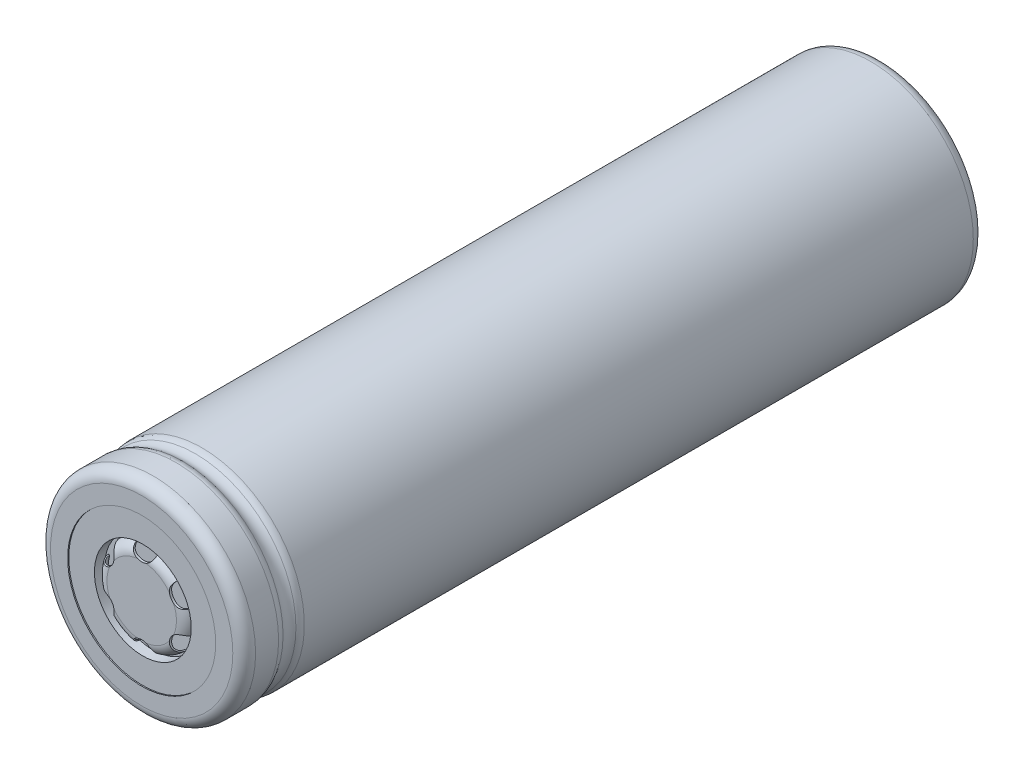
from build123d import *

# Parameters (mm, degrees)
SKETCH_1_R          = 9
EXTRUDE_1_DEPTH     = 65
SKETCH_2_R          = 4.25
SKETCH_2_R_2        = 4.05
CUT_EXTRUDE_1_DEPTH = 1
SKETCH_3_R          = 6.5
SKETCH_3_R_2        = 4.25
CUT_EXTRUDE_2_DEPTH = 0.1
FILLET_1_R          = 1
CUT_EXTRUDE_START   = -0.1
SKETCH_4_R          = 6.5
CUT_EXTRUDE_3_DEPTH = 0.1
FILLET_2_R          = 1
CUT_EXTRUDE_4_DEPTH = 1
CUT_EXTRUDE_5_DEPTH = 0.05
FILLET_3_R          = 1


with BuildPart() as part:
    # Эскиз1 → Бобышка-Вытянуть1 (new body)
    with BuildSketch(Plane.XY):
        Circle(SKETCH_1_R)
    extrude(amount=EXTRUDE_1_DEPTH)

    # Эскиз2 → Вырез-Вытянуть1 (cut)
    with BuildSketch(Plane.XY.offset(65)):
        Circle(SKETCH_2_R)
        Circle(SKETCH_2_R_2, mode=Mode.SUBTRACT)
    extrude(amount=-CUT_EXTRUDE_1_DEPTH, mode=Mode.SUBTRACT)

    # Эскиз3 → Вырез-Вытянуть2 (cut)
    with BuildSketch(Plane.XY.offset(65)):
        Circle(SKETCH_3_R)
        Circle(SKETCH_3_R_2, mode=Mode.SUBTRACT)
    extrude(amount=-CUT_EXTRUDE_2_DEPTH, mode=Mode.SUBTRACT)

    # Скругление1
    fillet_1_edges = [part.edges().sort_by_distance(p)[0] for p in [
        (-9, 0, 0),
        (-9, 0, 65),
    ]]
    fillet(fillet_1_edges, radius=FILLET_1_R)

    # Эскиз4 → Вырез-Вытянуть3 (cut)
    with BuildSketch(Plane(origin=(0, 0, 0), x_dir=(-1, 0, 0), z_dir=(0, 0, -1)).offset(CUT_EXTRUDE_START)):
        with Locations(Location((0, 0, 0), (0, 0, 180))):
            Circle(SKETCH_4_R)
    extrude(amount=CUT_EXTRUDE_3_DEPTH, mode=Mode.SUBTRACT)

    # Скругление2
    fillet_2_edges = [part.edges().sort_by_distance(p)[0] for p in [
        (-4.05, 0, 65),
    ]]
    fillet(fillet_2_edges, radius=FILLET_2_R - 0.0001)  # a hair under: the kernel refuses the full size

    # Эскиз5 → Вырез-Вытянуть4 (cut)
    with BuildSketch(Plane.XY.offset(65)):
        with BuildLine():
            ThreePointArc((-0.999373956, 3.924761355), (0, 2.960140663), (0.999373956, 3.924761355))
            ThreePointArc((0.999373956, 3.924761355), (0, 4.05), (-0.999373956, 3.924761355))
        make_face()
        with BuildLine():
            ThreePointArc((2.899256059, 2.827863912), (2.563557013, 1.480070332), (3.898630016, 1.096897444))
            ThreePointArc((3.898630016, 1.096897444), (3.507402885, 2.025), (2.899256059, 2.827863912))
        make_face()
        with BuildLine():
            ThreePointArc((3.898630016, -1.096897444), (2.563557013, -1.480070332), (2.899256059, -2.827863912))
            ThreePointArc((2.899256059, -2.827863912), (3.507402885, -2.025), (3.898630016, -1.096897444))
        make_face()
        with BuildLine():
            ThreePointArc((0.999373956, -3.924761355), (0, -2.960140663), (-0.999373956, -3.924761355))
            ThreePointArc((-0.999373956, -3.924761355), (0, -4.05), (0.999373956, -3.924761355))
        make_face()
        with BuildLine():
            ThreePointArc((-2.899256059, -2.827863912), (-2.563557013, -1.480070332), (-3.898630016, -1.096897444))
            ThreePointArc((-3.898630016, -1.096897444), (-3.507402885, -2.025), (-2.899256059, -2.827863912))
        make_face()
        with BuildLine():
            ThreePointArc((-3.898630016, 1.096897444), (-2.563557013, 1.480070332), (-2.899256059, 2.827863912))
            ThreePointArc((-2.899256059, 2.827863912), (-3.507402885, 2.025), (-3.898630016, 1.096897444))
        make_face()
    extrude(amount=-CUT_EXTRUDE_4_DEPTH, mode=Mode.SUBTRACT)

    # Эскиз6 → Вырез-Повернуть1 (revolve, cut)
    with BuildSketch(Plane(origin=(0, 0, 0), x_dir=(1, 0, 0), z_dir=(0, 1, 0))):
        with BuildLine():
            ThreePointArc((-3.2, -64.8), (-3.730330086, -64.580330086), (-3.95, -64.05))
            Line((-3.95, -64.05), (0, -64.05))
            Line((0, -64.05), (0, -64.8))
            Line((0, -64.8), (-3.2, -64.8))
        make_face()
    revolve(axis=Axis((0, 0, 0), (0, 0, 1)), mode=Mode.SUBTRACT)

    # Эскиз7 → Вырез-Вытянуть5 (cut)
    with BuildSketch(Plane.XY.offset(64.05)):
        with BuildLine():
            ThreePointArc((2.816140933, 2.769810507), (2.563557013, 1.480070332), (3.806796729, 1.053944335))
            ThreePointArc((3.806796729, 1.053944335), (3.95, 0), (3.806796729, -1.053944335))
            ThreePointArc((3.806796729, -1.053944335), (2.563557013, -1.480070332), (2.816140933, -2.769810507))
            ThreePointArc((2.816140933, -2.769810507), (1.975, -3.420800345), (0.990655797, -3.823754842))
            ThreePointArc((0.990655797, -3.823754842), (0, -2.960140663), (-0.990655797, -3.823754842))
            ThreePointArc((-0.990655797, -3.823754842), (-1.975, -3.420800345), (-2.816140933, -2.769810507))
            ThreePointArc((-2.816140933, -2.769810507), (-2.563557013, -1.480070332), (-3.806796729, -1.053944335))
            ThreePointArc((-3.806796729, -1.053944335), (-3.95, 0), (-3.806796729, 1.053944335))
            ThreePointArc((-3.806796729, 1.053944335), (-2.563557013, 1.480070332), (-2.816140933, 2.769810507))
            ThreePointArc((-2.816140933, 2.769810507), (-1.975, 3.420800345), (-0.990655797, 3.823754842))
            ThreePointArc((-0.990655797, 3.823754842), (0, 2.960140663), (0.990655797, 3.823754842))
            ThreePointArc((0.990655797, 3.823754842), (1.975, 3.420800345), (2.816140933, 2.769810507))
        make_face()
    extrude(amount=-CUT_EXTRUDE_5_DEPTH, mode=Mode.SUBTRACT)

    # Эскиз8 → Вырез-Повернуть2 (revolve, cut)
    with BuildSketch(Plane(origin=(0, 0, 0), x_dir=(1, 0, 0), z_dir=(0, 1, 0)), mode=Mode.PRIVATE) as cut_revolve_2_sk:
        with BuildLine():
            Line((9.586660954, -61.847992067), (9.586660954, -59.852007933))
            ThreePointArc((9.586660954, -59.852007933), (8.65, -60.85), (9.586660954, -61.847992067))
        make_face()
    revolve(cut_revolve_2_sk.sketch.rotate(Axis((0, 0, 0), (0, 0, 1)), 180), axis=Axis((0, 0, 0), (0, 0, 1)), mode=Mode.SUBTRACT)

    # Скругление3
    fillet_3_edges = [part.edges().sort_by_distance(p)[0] for p in [
        (0, 9, 60.090065792),
        (0, 9, 61.609934208),
    ]]
    fillet(fillet_3_edges, radius=FILLET_3_R)


solid = part.part
